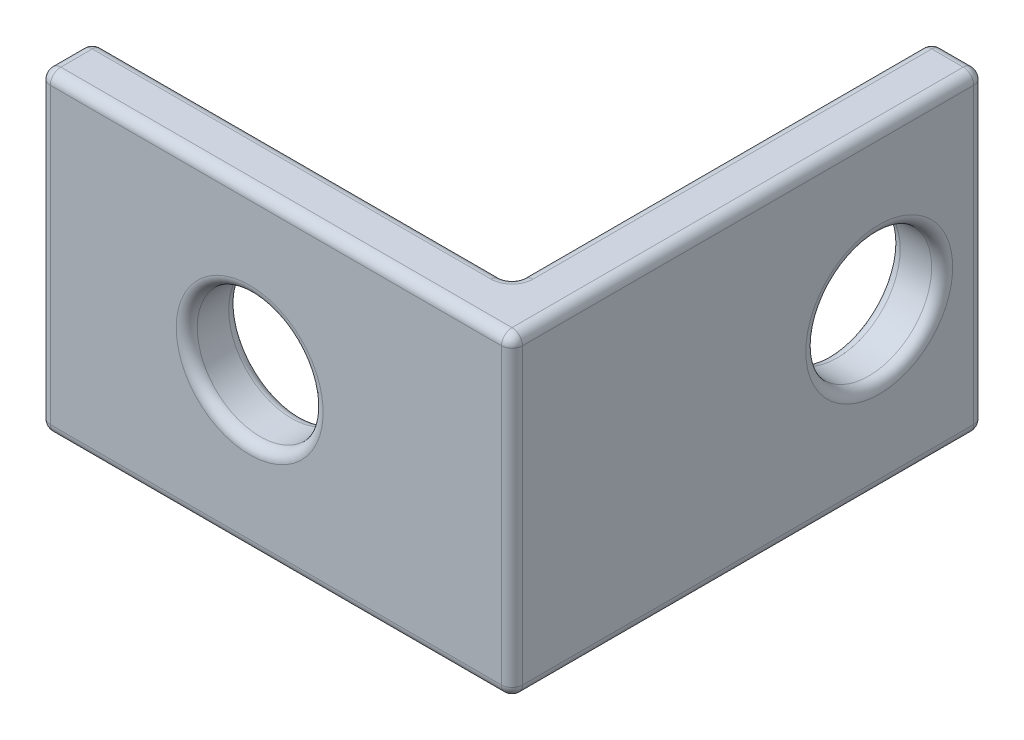
from build123d import *

# Parameters (mm, degrees)
BOSS_EXTRUDE2_DEPTH = 15
SKETCH4_R           = 3
CUT_EXTRUDE2_DEPTH  = 34.634060118
SKETCH7_R           = 3
CUT_EXTRUDE4_DEPTH  = 34.634060118
FILLET1_R           = 0.5


with BuildPart() as part:
    # Sketch3 → Boss-Extrude2 (new body)
    with BuildSketch(Plane(origin=(0, 0, 0), x_dir=(1, 0, 0), z_dir=(0, 1, 0))):
        Polygon((0, 0), (22.5, 0), (22.5, 22.5), (20, 22.5), (20, 2.5), (0, 2.5), align=None)
    extrude(amount=BOSS_EXTRUDE2_DEPTH)

    # Sketch4 → Cut-Extrude2 (cut, through all)
    with BuildSketch(Plane(origin=(0, 0, -2.5), x_dir=(-1, 0, 0), z_dir=(0, 0, -1))):
        with Locations((-10, 7.5)):
            Circle(SKETCH4_R)
    extrude(amount=-CUT_EXTRUDE2_DEPTH, mode=Mode.SUBTRACT)

    # Sketch7 → Cut-Extrude4 (cut, through all)
    with BuildSketch(Plane.ZY.offset(-20)):
        with Locations((-17.5, 7.5)):
            Circle(SKETCH7_R)
    extrude(amount=-CUT_EXTRUDE4_DEPTH, mode=Mode.SUBTRACT)

    # Fillet1
    fillet1_edges = [part.edges().sort_by_distance(p)[0] for p in [
        (22.5, 7.5, 0),
        (22.5, 15, -11.25),
        (11.25, 15, 0),
        (11.25, 0, 0),
        (22.5, 0, -11.25),
        (0, 15, -1.25),
        (0, 7.5, 0),
        (0, 0, -1.25),
        (22.5, 7.5, -22.5),
        (21.25, 15, -22.5),
        (21.25, 0, -22.5),
        (10, 15, -2.5),
        (0, 7.5, -2.5),
        (10, 0, -2.5),
        (13, 7.5, -2.5),
        (20, 7.5, -22.5),
        (20, 15, -12.5),
        (20, 7.5, -2.5),
        (20, 0, -12.5),
        (20, 7.5, -20.5),
        (13, 7.5, 0),
        (22.5, 7.5, -20.5),
    ]]
    fillet(fillet1_edges, radius=FILLET1_R)


solid = part.part
